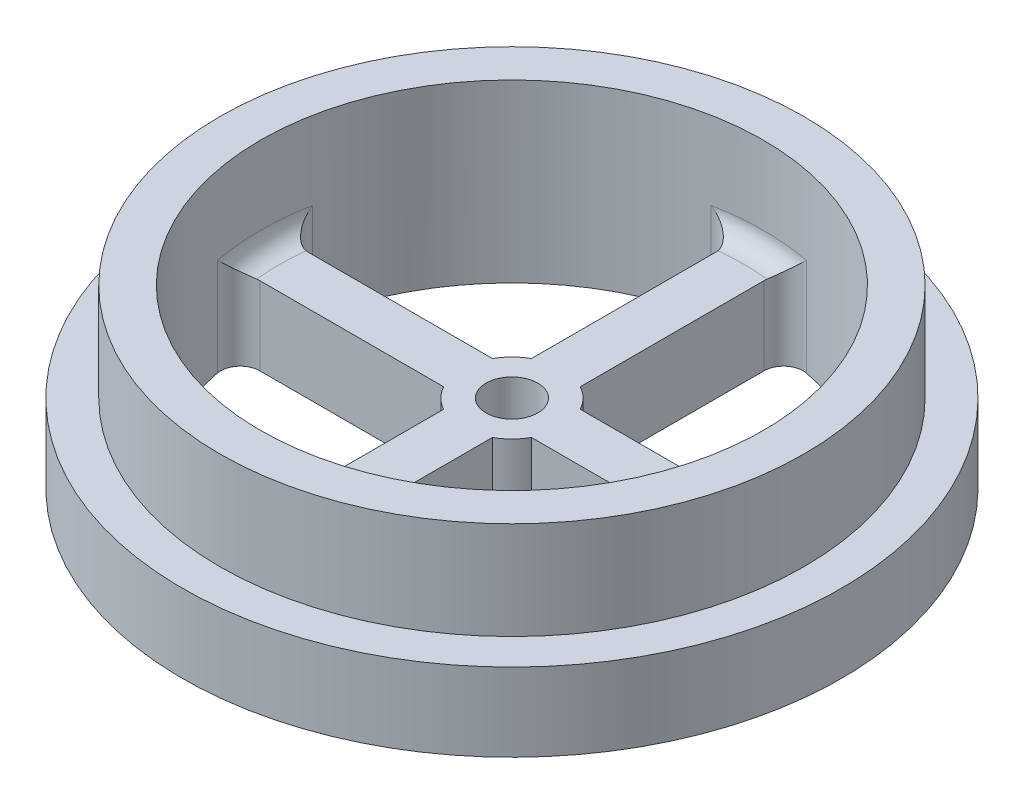
from build123d import *
from build123d.topology import SkipClean

# Parameters (mm, degrees)
SKETCH2_R           = 3.3655
BOSS_EXTRUDE1_DEPTH = 10.16
FILLET1_START       = 10.16
FILLET1_OUTLINE_R   = 32.7025
FILLET1_DEPTH       = 2.5400001
FILLET1_2_DEPTH     = 10.16
FILLET1_4_DEPTH     = 5.080000101


with BuildPart() as part:
    # Sketch1 → Revolve2 (revolve)
    with BuildSketch(Plane.XY, mode=Mode.PRIVATE) as revolve2_sk:
        Polygon((42.8625, 0), (42.8625, 10.16), (37.9984, 10.16), (37.9984, 22.86), (32.7025, 22.86), (32.7025, 0), align=None)
    revolve(revolve2_sk.sketch.rotate(Axis((0, 22.86, 0), (0, -1, 0)), 180), axis=Axis((0, 22.86, 0), (0, -1, 0)))

    # Sketch2 → Boss-Extrude1 (add)
    with BuildSketch(Plane.XZ):
        with BuildLine():
            Line((-3.175, 32.548008868), (-3.175, 5.718174119))
            ThreePointArc((-3.175, 5.718174119), (-4.624831902, 4.624831902), (-5.718174119, 3.175))
            Line((-5.718174119, 3.175), (-32.548008868, 3.175))
            ThreePointArc((-32.548008868, 3.175), (-32.7025, 0), (-32.548008868, -3.175))
            Line((-32.548008868, -3.175), (-5.718174119, -3.175))
            ThreePointArc((-5.718174119, -3.175), (-4.624831902, -4.624831902), (-3.175, -5.718174119))
            Line((-3.175, -5.718174119), (-3.175, -32.548008868))
            ThreePointArc((-3.175, -32.548008868), (0, -32.7025), (3.175, -32.548008868))
            Line((3.175, -32.548008868), (3.175, -5.718174119))
            ThreePointArc((3.175, -5.718174119), (4.624831902, -4.624831902), (5.718174119, -3.175))
            Line((5.718174119, -3.175), (32.548008868, -3.175))
            ThreePointArc((32.548008868, -3.175), (32.663854383, -1.58937822), (32.7025, 0))
            ThreePointArc((32.7025, 0), (32.663854383, 1.58937822), (32.548008868, 3.175))
            Line((32.548008868, 3.175), (5.718174119, 3.175))
            ThreePointArc((5.718174119, 3.175), (4.624831902, 4.624831902), (3.175, 5.718174119))
            Line((3.175, 5.718174119), (3.175, 32.548008868))
            ThreePointArc((3.175, 32.548008868), (0, 32.7025), (-3.175, 32.548008868))
        make_face()
        Circle(SKETCH2_R, mode=Mode.SUBTRACT)
    extrude(amount=-BOSS_EXTRUDE1_DEPTH)

    # Fillet1: read off the stored shape, not the designer's step
    # Fillet1 outline → Fillet1 (add)
    with BuildSketch(Plane(origin=(0, 0, 0), x_dir=(1, 0, 0), z_dir=(0, 1, 0)).offset(FILLET1_START)):
        Circle(FILLET1_OUTLINE_R)
    extrude(amount=FILLET1_DEPTH)

    # Fillet1 2 outline → Fillet1 2 (add)
    with BuildSketch(Plane(origin=(0, 0, 0), x_dir=(1, 0, 0), z_dir=(0, 1, 0))):
        with BuildLine():
            ThreePointArc((-29.616130423, 3.175), (-31.574957677, 4.098028822), (-32.110120354, 6.196263158))
            ThreePointArc((-32.110120354, 6.196263158), (-32.364338806, 4.690744065), (-32.548008868, 3.175))
            Line((-32.548008868, 3.175), (-29.616130423, 3.175))
        make_face()
        with BuildLine():
            ThreePointArc((-3.175, 32.548008868), (-4.690744065, 32.364338806), (-6.196263158, 32.110120354))
            ThreePointArc((-6.196263158, 32.110120354), (-4.098028822, 31.574957677), (-3.175, 29.616130423))
            Line((-3.175, 29.616130423), (-3.175, 32.548008868))
        make_face()
        with BuildLine():
            Line((-29.616130423, -3.175), (-32.548008868, -3.175))
            ThreePointArc((-32.548008868, -3.175), (-32.364338806, -4.690744065), (-32.110120354, -6.196263158))
            ThreePointArc((-32.110120354, -6.196263158), (-31.574957677, -4.098028822), (-29.616130423, -3.175))
        make_face()
        with BuildLine():
            ThreePointArc((6.196263158, 32.110120354), (4.690744065, 32.364338806), (3.175, 32.548008868))
            Line((3.175, 32.548008868), (3.175, 29.616130423))
            ThreePointArc((3.175, 29.616130423), (4.098028822, 31.574957677), (6.196263158, 32.110120354))
        make_face()
        with BuildLine():
            ThreePointArc((-3.175, -29.616130423), (-4.098028822, -31.574957677), (-6.196263158, -32.110120354))
            ThreePointArc((-6.196263158, -32.110120354), (-4.690744065, -32.364338806), (-3.175, -32.548008868))
            Line((-3.175, -32.548008868), (-3.175, -29.616130423))
        make_face()
        with BuildLine():
            ThreePointArc((32.548008868, 3.175), (32.364338806, 4.690744065), (32.110120354, 6.196263158))
            ThreePointArc((32.110120354, 6.196263158), (31.574957677, 4.098028822), (29.616130423, 3.175))
            Line((29.616130423, 3.175), (32.548008868, 3.175))
        make_face()
        with BuildLine():
            Line((3.175, -29.616130423), (3.175, -32.548008868))
            ThreePointArc((3.175, -32.548008868), (4.690744065, -32.364338806), (6.196263158, -32.110120354))
            ThreePointArc((6.196263158, -32.110120354), (4.098028822, -31.574957677), (3.175, -29.616130423))
        make_face()
        with BuildLine():
            ThreePointArc((32.110120354, -6.196263158), (32.364338806, -4.690744065), (32.548008868, -3.175))
            Line((32.548008868, -3.175), (29.616130423, -3.175))
            ThreePointArc((29.616130423, -3.175), (31.574957677, -4.098028822), (32.110120354, -6.196263158))
        make_face()
    extrude(amount=FILLET1_2_DEPTH)

    # Fillet1 3 outline → Fillet1 3 (revolve, cut)
    with BuildSketch(Plane.XY):
        with BuildLine():
            Line((32.7025, 12.7), (0, 12.7))
            Line((0, 12.7), (0, 10.16))
            Line((0, 10.16), (30.1625, 10.16))
            ThreePointArc((30.1625, 10.16), (31.958551224, 10.903948776), (32.7025, 12.7))
        make_face()
    revolve(axis=Axis((0, 0, 0), (0, 1, 0)), mode=Mode.SUBTRACT)

    # Fillet1 4 outline → Fillet1 4 (cut)
    with SkipClean():  # the faces are left unmerged after this step: merging them gives an invalid solid
        with BuildSketch(Plane(origin=(0, 0, 0), x_dir=(1, 0, 0), z_dir=(0, 1, 0)).offset(FILLET1_START)):
            with BuildLine():
                ThreePointArc((29.616130423, 3.175), (31.574957677, 4.098028822), (32.110120354, 6.196263158))
                ThreePointArc((32.110120354, 6.196263158), (23.124159512, 23.124159512), (6.196263158, 32.110120354))
                ThreePointArc((6.196263158, 32.110120354), (4.098028822, 31.574957677), (3.175, 29.616130423))
                Line((3.175, 29.616130423), (3.175000002, 3.175000002))
                Line((3.175000002, 3.175000002), (29.616130423, 3.175))
            make_face()
            with BuildLine():
                Line((-29.616130423, 3.175), (-3.175000002, 3.175000002))
                Line((-3.175000002, 3.175000002), (-3.175, 29.616130423))
                ThreePointArc((-3.175, 29.616130423), (-4.098028822, 31.574957677), (-6.196263158, 32.110120354))
                ThreePointArc((-6.196263158, 32.110120354), (-23.124159512, 23.124159512), (-32.110120354, 6.196263158))
                ThreePointArc((-32.110120354, 6.196263158), (-31.574957677, 4.098028822), (-29.616130423, 3.175))
            make_face()
            with BuildLine():
                Line((29.616130423, -3.175), (3.175000002, -3.175000003))
                Line((3.175000002, -3.175000003), (3.175, -29.616130423))
                ThreePointArc((3.175, -29.616130423), (4.098028822, -31.574957677), (6.196263158, -32.110120354))
                ThreePointArc((6.196263158, -32.110120354), (23.124159512, -23.124159512), (32.110120354, -6.196263158))
                ThreePointArc((32.110120354, -6.196263158), (31.574957677, -4.098028822), (29.616130423, -3.175))
            make_face()
            with BuildLine():
                Line((-3.175, -29.616130423), (-3.175000003, -3.175000002))
                Line((-3.175000003, -3.175000002), (-29.616130423, -3.175))
                ThreePointArc((-29.616130423, -3.175), (-31.574957677, -4.098028822), (-32.110120354, -6.196263158))
                ThreePointArc((-32.110120354, -6.196263158), (-23.124159512, -23.124159512), (-6.196263158, -32.110120354))
                ThreePointArc((-6.196263158, -32.110120354), (-4.098028822, -31.574957677), (-3.175, -29.616130423))
            make_face()
        extrude(amount=FILLET1_4_DEPTH, mode=Mode.SUBTRACT)


solid = part.part
